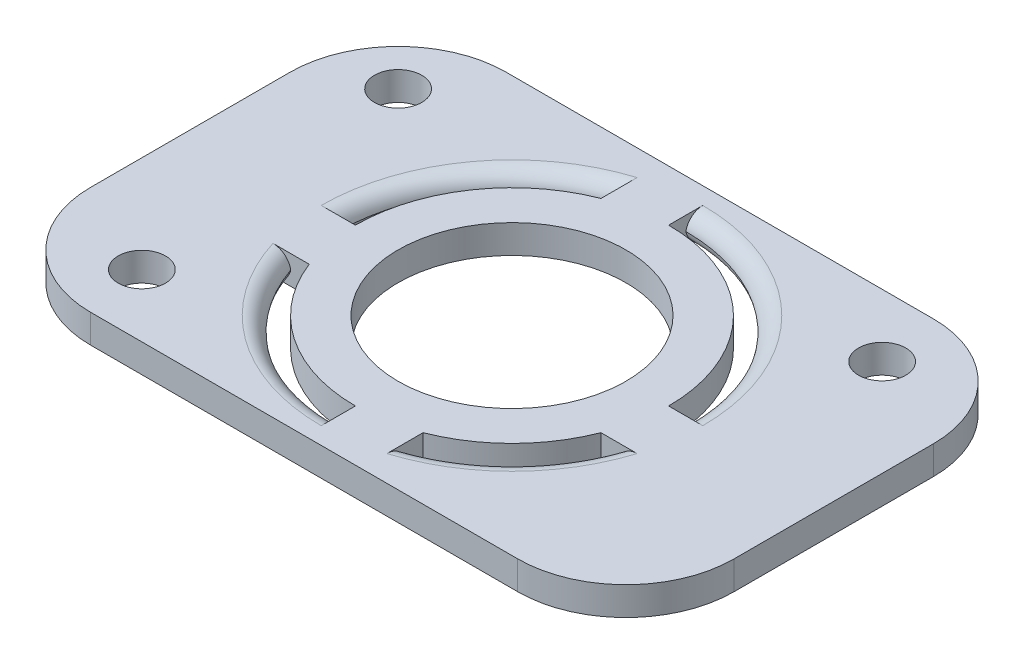
from build123d import *

# Parameters (mm, degrees)
SKETCH1_W           = 115
SKETCH1_H           = 75
SKETCH1_R           = 4.15
BOSS_EXTRUDE1_DEPTH = 5
FILLET1_R           = 20
SKETCH5_R           = 4.15
CUT_EXTRUDE4_DEPTH  = 10
CUT_EXTRUDE7_DEPTH  = 16
SKETCH12_R          = 20
CUT_EXTRUDE8_DEPTH  = 10
FILLET2_R           = 3


with BuildPart() as part:
    # Sketch1 → Boss-Extrude1 (new body)
    with BuildSketch(Plane(origin=(0, 0, 0), x_dir=(1, 0, 0), z_dir=(0, 1, 0))):
        Rectangle(SKETCH1_W, SKETCH1_H)
        with Locations(Location((-44.48, 24.48, 0), (0, 0, 270))):
            Circle(SKETCH1_R, mode=Mode.SUBTRACT)
    extrude(amount=BOSS_EXTRUDE1_DEPTH)

    # Fillet1
    fillet1_edges = [part.edges().sort_by_distance(p)[0] for p in [
        (57.5, 2.5, 37.5),
        (-57.5, 2.5, 37.5),
        (-57.5, 2.5, -37.5),
        (57.5, 2.5, -37.5),
    ]]
    fillet(fillet1_edges, radius=FILLET1_R)

    # Sketch5 → Cut-Extrude4 (cut)
    with BuildSketch(Plane.XZ):
        with Locations(Location((-39.5, 25.5, 0), (0, 0, 270))):
            Circle(SKETCH5_R)
        with Locations(Location((39.5, -25.5, 0), (0, 0, 270))):
            Circle(SKETCH5_R)
    extrude(amount=-CUT_EXTRUDE4_DEPTH, mode=Mode.SUBTRACT)

    # Sketch11 → Cut-Extrude7 (cut)
    with BuildSketch(Plane(origin=(0, 5, 0), x_dir=(1, 0, 0), z_dir=(0, 1, 0))):
        with BuildLine():
            Line((57.5, -17.5), (57.5, 17.5))
            ThreePointArc((57.5, 17.5), (51.642135624, 31.642135624), (37.5, 37.5))
            Line((37.5, 37.5), (-37.5, 37.5))
            ThreePointArc((-37.5, 37.5), (-51.642135624, 31.642135624), (-57.5, 17.5))
            Line((-57.5, 17.5), (-57.5, -17.5))
            ThreePointArc((-57.5, -17.5), (-51.642135624, -31.642135624), (-37.5, -37.5))
            Line((-37.5, -37.5), (37.5, -37.5))
            ThreePointArc((37.5, -37.5), (51.642135624, -31.642135624), (57.5, -17.5))
        make_face()
        with BuildLine():
            Line((37.5, 36.5), (-37.5, 36.5))
            ThreePointArc((-37.5, 36.5), (-50.935028843, 30.935028843), (-56.5, 17.5))
            Line((-56.5, 17.5), (-56.5, -17.5))
            ThreePointArc((-56.5, -17.5), (-50.935028843, -30.935028843), (-37.5, -36.5))
            Line((-37.5, -36.5), (37.5, -36.5))
            ThreePointArc((37.5, -36.5), (50.935028843, -30.935028843), (56.5, -17.5))
            Line((56.5, -17.5), (56.5, 17.5))
            ThreePointArc((56.5, 17.5), (50.935028843, 30.935028843), (37.5, 36.5))
        make_face(mode=Mode.SUBTRACT)
    extrude(amount=-CUT_EXTRUDE7_DEPTH, mode=Mode.SUBTRACT)

    # Sketch12 → Cut-Extrude8 (cut)
    with BuildSketch(Plane(origin=(0, 5, 0), x_dir=(1, 0, 0), z_dir=(0, 1, 0))):
        with Locations(Location((0, 0, 0), (0, 0, 270))):
            Circle(SKETCH12_R)
        with BuildLine():
            Line((0, 30.5), (0, 27.5))
            ThreePointArc((0, 27.5), (19.445436483, 19.445436483), (27.5, 0))
            Line((27.5, 0), (30.5, 0))
            ThreePointArc((30.5, 0), (21.566756826, 21.566756826), (0, 30.5))
        make_face()
        with BuildLine():
            Line((-30.5, 0), (-27.5, 0))
            ThreePointArc((-27.5, 0), (-22.707377656, 15.512092057), (-10, 25.617376915))
            Line((-10, 25.617376915), (-10, 28.814059068))
            ThreePointArc((-10, 28.814059068), (-24.852062289, 17.68120471), (-30.5, 0))
        make_face()
        with BuildLine():
            Line((0, -30.5), (0, -27.5))
            ThreePointArc((0, -27.5), (-15.512092057, -22.707377656), (-25.617376915, -10))
            Line((-25.617376915, -10), (-28.814059068, -10))
            ThreePointArc((-28.814059068, -10), (-17.68120471, -24.852062289), (0, -30.5))
        make_face()
        with BuildLine():
            Line((25.617376915, -10), (28.814059068, -10))
            ThreePointArc((28.814059068, -10), (21.566756826, -21.566756826), (10, -28.814059068))
            Line((10, -28.814059068), (10, -25.617376915))
            ThreePointArc((10, -25.617376915), (19.445436483, -19.445436483), (25.617376915, -10))
        make_face()
    extrude(amount=-CUT_EXTRUDE8_DEPTH, mode=Mode.SUBTRACT)

    # Fillet2
    # the kernel refuses this fillet: 3 mm, written as the material it takes off along each edge
    with BuildSketch(Plane(origin=(0, 0, 0), x_dir=(-0.9961231139534353, 0, 0.08797011906159574), z_dir=(-0.08797011906159574, 0, -0.9961231139534353))) as fillet2_piece_1_section:
        with BuildLine():
            CenterArc((30.5 + FILLET2_R, FILLET2_R), FILLET2_R, 180, 90)
            Line((30.5, FILLET2_R), (30.5, 0))
            Line((30.5, 0), (30.5 + FILLET2_R, 0))
        make_face()
    fillet2_piece_1 = revolve(axis=Axis((0, 0, 0), (0, 1, 0)), revolution_arc=84.953159759, mode=Mode.PRIVATE)
    fillet2_piece_1 = split(fillet2_piece_1, bisect_by=Plane(origin=(-18.564957711, 0.847104703, 10), z_dir=(0, 0, 1)), keep=Keep.TOP, mode=Mode.PRIVATE)
    add(fillet2_piece_1, mode=Mode.SUBTRACT)
    with BuildSketch(Plane(origin=(0, 0, 0), x_dir=(-0.08797011906159563, 0, -0.9961231139534353), z_dir=(0.9961231139534353, 0, -0.08797011906159563))) as fillet2_piece_2_section:
        with BuildLine():
            CenterArc((30.5 + FILLET2_R, FILLET2_R), FILLET2_R, 180, 90)
            Line((30.5, FILLET2_R), (30.5, 0))
            Line((30.5, 0), (30.5 + FILLET2_R, 0))
        make_face()
    fillet2_piece_2 = revolve(axis=Axis((0, 0, 0), (0, 1, 0)), revolution_arc=84.953159759, mode=Mode.PRIVATE)
    fillet2_piece_2 = split(fillet2_piece_2, bisect_by=Plane(origin=(-10, 0.847104703, -18.564957711), z_dir=(-1, 0, 0)), keep=Keep.TOP, mode=Mode.PRIVATE)
    add(fillet2_piece_2, mode=Mode.SUBTRACT)
    with BuildSketch(Plane(origin=(0, 0, 0), x_dir=(1, 0, 0), z_dir=(0, 0, 1))) as fillet2_piece_3:
        with BuildLine():
            CenterArc((30.5 + FILLET2_R, FILLET2_R), FILLET2_R, 180, 90)
            Line((30.5, FILLET2_R), (30.5, 0))
            Line((30.5, 0), (30.5 + FILLET2_R, 0))
        make_face()
    revolve(axis=Axis((0, 0, 0), (0, 1, 0)), revolution_arc=90, mode=Mode.SUBTRACT)
    with BuildSketch(Plane(origin=(0, 0, 0), x_dir=(0.08799861930970912, 0, 0.9961205966144786), z_dir=(-0.9961205966144786, 0, 0.08799861930970912))) as fillet2_piece_4_section:
        with BuildLine():
            CenterArc((30.5 + FILLET2_R, FILLET2_R), FILLET2_R, 180, 90)
            Line((30.5, FILLET2_R), (30.5, 0))
            Line((30.5, 0), (30.5 + FILLET2_R, 0))
        make_face()
    fillet2_piece_4 = revolve(axis=Axis((0, 0, 0), (0, 1, 0)), revolution_arc=79.903040915, mode=Mode.PRIVATE)
    fillet2_piece_4 = split(fillet2_piece_4, bisect_by=Plane(origin=(10, 0.85015092, 22.167904307), z_dir=(1, 0, 0)), keep=Keep.TOP, mode=Mode.PRIVATE)
    fillet2_piece_4 = split(fillet2_piece_4, bisect_by=Plane(origin=(22.167904307, 0.85015092, 10), z_dir=(0, 0, 1)), keep=Keep.TOP, mode=Mode.PRIVATE)
    add(fillet2_piece_4, mode=Mode.SUBTRACT)
    with BuildSketch(Plane(origin=(0, 5, 0), x_dir=(-0.9961231139534353, 0, 0.08797011906159574), z_dir=(-0.08797011906159574, 0, -0.9961231139534353))) as fillet2_piece_5_section:
        with BuildLine():
            CenterArc((30.5 + FILLET2_R, -FILLET2_R), FILLET2_R, 90, 90)
            Line((30.5 + FILLET2_R, 0), (30.5, 0))
            Line((30.5, 0), (30.5, -FILLET2_R))
        make_face()
    fillet2_piece_5 = revolve(axis=Axis((0, 5, 0), (0, 1, 0)), revolution_arc=84.953159759, mode=Mode.PRIVATE)
    fillet2_piece_5 = split(fillet2_piece_5, bisect_by=Plane(origin=(-18.564957711, 4.152895297, 10), z_dir=(0, 0, 1)), keep=Keep.TOP, mode=Mode.PRIVATE)
    add(fillet2_piece_5, mode=Mode.SUBTRACT)
    with BuildSketch(Plane(origin=(0, 5, 0), x_dir=(-0.08797011906159553, 0, -0.9961231139534353), z_dir=(0.9961231139534353, 0, -0.08797011906159553))) as fillet2_piece_6_section:
        with BuildLine():
            CenterArc((30.5 + FILLET2_R, -FILLET2_R), FILLET2_R, 90, 90)
            Line((30.5 + FILLET2_R, 0), (30.5, 0))
            Line((30.5, 0), (30.5, -FILLET2_R))
        make_face()
    fillet2_piece_6 = revolve(axis=Axis((0, 5, 0), (0, 1, 0)), revolution_arc=84.953159759, mode=Mode.PRIVATE)
    fillet2_piece_6 = split(fillet2_piece_6, bisect_by=Plane(origin=(-10, 4.152895297, -18.564957711), z_dir=(-1, 0, 0)), keep=Keep.TOP, mode=Mode.PRIVATE)
    add(fillet2_piece_6, mode=Mode.SUBTRACT)
    with BuildSketch(Plane(origin=(0, 5, 0), x_dir=(0.9961205966144787, 0, 0.08799861930970913), z_dir=(0.08799861930970913, 0, -0.9961205966144787))) as fillet2_piece_7_section:
        with BuildLine():
            CenterArc((30.5 + FILLET2_R, FILLET2_R), FILLET2_R, 180, 90)
            Line((30.5 + FILLET2_R, 0), (30.5, 0))
            Line((30.5, 0), (30.5, FILLET2_R))
        make_face()
    fillet2_piece_7 = revolve(axis=Axis((0, 5, 0), (0, -1, 0)), revolution_arc=79.903040915, mode=Mode.PRIVATE)
    fillet2_piece_7 = split(fillet2_piece_7, bisect_by=Plane(origin=(10, 4.149849079, 22.167904307), z_dir=(1, 0, 0)), keep=Keep.TOP, mode=Mode.PRIVATE)
    fillet2_piece_7 = split(fillet2_piece_7, bisect_by=Plane(origin=(22.167904307, 4.149849079, 10), z_dir=(0, 0, 1)), keep=Keep.TOP, mode=Mode.PRIVATE)
    add(fillet2_piece_7, mode=Mode.SUBTRACT)
    with BuildSketch(Plane(origin=(0, 5, 0), x_dir=(1, 0, 0), z_dir=(0, 0, 1))) as fillet2_piece_8:
        with BuildLine():
            CenterArc((30.5 + FILLET2_R, -FILLET2_R), FILLET2_R, 90, 90)
            Line((30.5 + FILLET2_R, 0), (30.5, 0))
            Line((30.5, 0), (30.5, -FILLET2_R))
        make_face()
    revolve(axis=Axis((0, 5, 0), (0, 1, 0)), revolution_arc=90, mode=Mode.SUBTRACT)


solid = part.part
